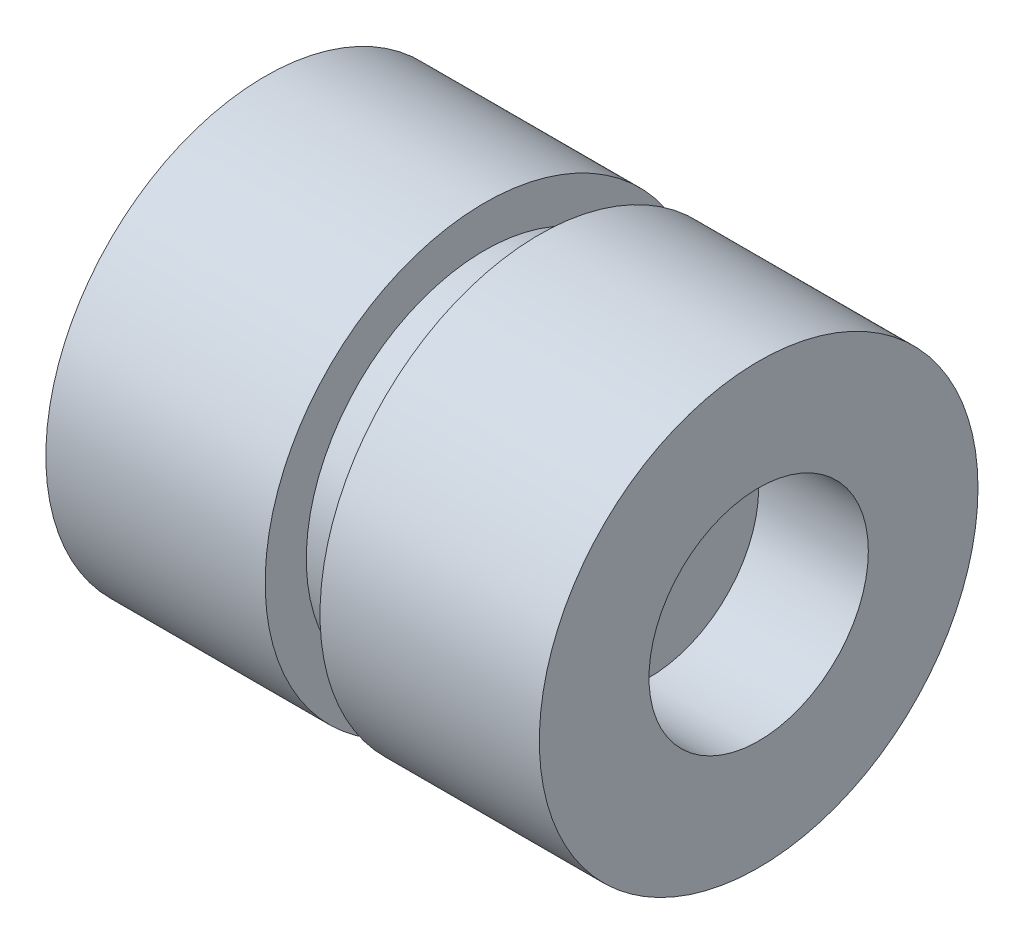
from build123d import *

# Parameters (mm, degrees)
SKETCH8_R          = 50.8
CUT_EXTRUDE3_DEPTH = 50.8


with BuildPart() as part:
    # Sketch1 → Revolve2 (revolve)
    with BuildSketch(Plane.XY, mode=Mode.PRIVATE) as revolve2_sk:
        Polygon((0, 101.6), (101.6, 101.6), (101.6, 0), (0, 0), (-25.4, 0), (-127, 0), (-127, 101.6), (-25.4, 101.6), (-25.4, 82.55), (0, 82.55), align=None)
    revolve(revolve2_sk.sketch.rotate(Axis((141.005607477, 0, 0), (-1, 0, 0)), 90), axis=Axis((141.005607477, 0, 0), (-1, 0, 0)))

    # Sketch8 → Cut-Extrude3 (cut)
    with BuildSketch(Plane(origin=(101.6, 0, 0), x_dir=(0, 0, -1), z_dir=(1, 0, 0))):
        Circle(SKETCH8_R)
    extrude(amount=-CUT_EXTRUDE3_DEPTH, mode=Mode.SUBTRACT)

    # Cut-Loft1: read off the stored shape, not the designer's step
    # Cut-Loft1: loft between two sections, ruled curve by curve
    cut_loft1_from = [
        Edge.make_bspline([(-127, 1.659470947, -50.772888003), (-127, 103.205246954, -47.453946108), (-127, 99.886305059, 54.091829898), (-127, -1.659470947, 50.772888003), (-127, -103.205246954, 47.453946108), (-127, -99.886305059, -54.091829898), (-127, 1.659470947, -50.772888003)], [0, 0, 0, 0, 0.5, 0.5, 0.5, 1, 1, 1, 1], 3, [1, 0.333333333, 0.333333333, 1, 0.333333333, 0.333333333, 1]),
    ]
    cut_loft1_to = [
        Edge.make_bspline([(-57.15, -3.878953486, -12.093126967), (-57.15, 20.307300449, -19.85103394), (-57.15, 28.065207421, 4.335219995), (-57.15, 3.878953486, 12.093126967), (-57.15, -20.307300449, 19.85103394), (-57.15, -28.065207421, -4.335219995), (-57.15, -3.878953486, -12.093126967)], [0, 0, 0, 0, 0.5, 0.5, 0.5, 1, 1, 1, 1], 3, [1, 0.333333333, 0.333333333, 1, 0.333333333, 0.333333333, 1]),
    ]
    cut_loft1 = Solid(Shell([*[Face.make_surface_from_curves(cut_loft1_from[k], cut_loft1_to[k]) for k in range(1)], Face(Wire(cut_loft1_from)), Face(Wire(cut_loft1_to))]))
    add(cut_loft1, mode=Mode.SUBTRACT)


solid = part.part
